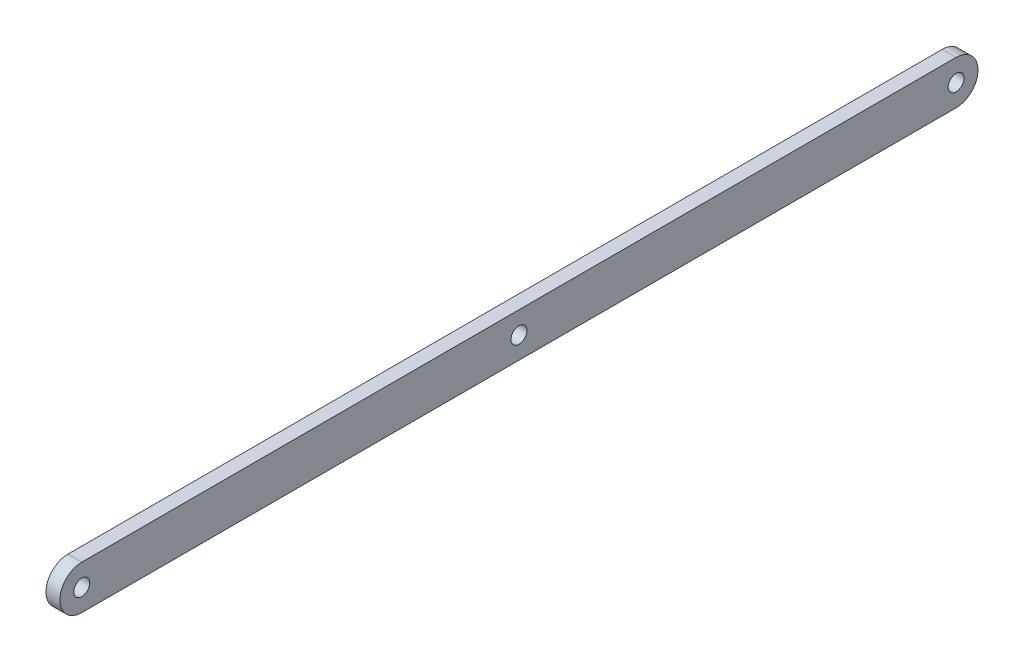
from build123d import *

# Parameters (mm, degrees)
SKETCH1_R           = 1.8288
BOSS_EXTRUDE1_DEPTH = 3.175


with BuildPart() as part:
    # Sketch1 → Boss-Extrude1 (new body)
    with BuildSketch(Plane(origin=(0, 0, 0), x_dir=(0, 0, -1), z_dir=(1, 0, 0))):
        with BuildLine():
            Line((100, 5), (-100, 5))
            ThreePointArc((-100, 5), (-105, 0), (-100, -5))
            Line((-100, -5), (100, -5))
            ThreePointArc((100, -5), (105, 0), (100, 5))
        make_face()
        with Locations((-100, 0)):
            Circle(SKETCH1_R, mode=Mode.SUBTRACT)
        Circle(SKETCH1_R, mode=Mode.SUBTRACT)
        with Locations((100, 0)):
            Circle(SKETCH1_R, mode=Mode.SUBTRACT)
    extrude(amount=BOSS_EXTRUDE1_DEPTH)


solid = part.part
